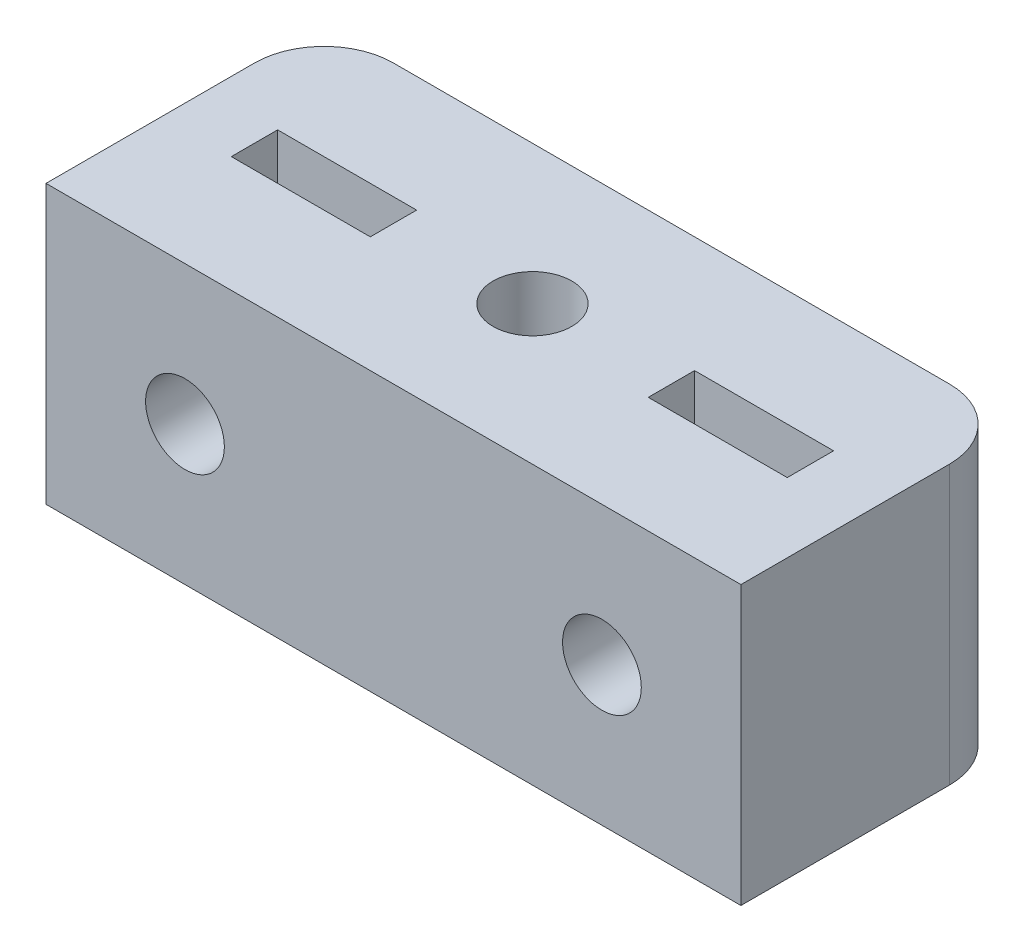
from build123d import *

# Parameters (mm, degrees)
SKETCH1_W           = 30
SKETCH1_H           = 12
BOSS_EXTRUDE1_DEPTH = 6
SKETCH2_R           = 1.7
CUT_EXTRUDE1_DEPTH  = 21.124611797
CUT_EXTRUDE2_DEPTH  = 1
SKETCH4_R           = 1.7
CUT_EXTRUDE3_DEPTH  = 21.124611797
CUT_EXTRUDE4_DEPTH  = 1
FILLET1_R           = 3


with BuildPart() as part:
    # Sketch1 → Boss-Extrude1 (new, symmetric)
    with BuildSketch(Plane(origin=(0, 0, 0), x_dir=(1, 0, 0), z_dir=(0, 1, 0))):
        Rectangle(SKETCH1_W, SKETCH1_H)
    extrude(amount=BOSS_EXTRUDE1_DEPTH, both=True)

    # Sketch2 → Cut-Extrude1 (cut, through all)
    with BuildSketch(Plane.XY.offset(6)):
        with Locations((-9, 0)):
            Circle(SKETCH2_R)
    cut_extrude1 = extrude(amount=-CUT_EXTRUDE1_DEPTH, mode=Mode.SUBTRACT)

    # Sketch3 → Cut-Extrude2 (cut, symmetric)
    with BuildSketch(Plane.XY):
        Polygon((-12, 3), (-12, 6), (-6, 6), (-6, 3), (-6, -3), (-12, -3), align=None)
    cut_extrude2 = extrude(amount=CUT_EXTRUDE2_DEPTH, both=True, mode=Mode.SUBTRACT)

    # Mirror1: Cut-Extrude1, Cut-Extrude2 across plane
    add(cut_extrude1.mirror(Plane(origin=(0, 0, 0), x_dir=(0, 0, 1), z_dir=(1, 0, 0))), mode=Mode.SUBTRACT)
    add(cut_extrude2.mirror(Plane(origin=(0, 0, 0), x_dir=(0, 0, 1), z_dir=(1, 0, 0))), mode=Mode.SUBTRACT)

    # Sketch4 → Cut-Extrude3 (cut, through all)
    with BuildSketch(Plane(origin=(0, 6, 0), x_dir=(1, 0, 0), z_dir=(0, 1, 0))):
        Circle(SKETCH4_R)
    extrude(amount=-CUT_EXTRUDE3_DEPTH, mode=Mode.SUBTRACT)

    # Sketch5 → Cut-Extrude4 (cut, symmetric)
    with BuildSketch(Plane(origin=(0, 0, 0), x_dir=(1, 0, 0), z_dir=(0, 1, 0))):
        Polygon((-3, 3), (-3, 6), (3, 6), (3, 3), (3, -3), (-3, -3), align=None)
    extrude(amount=CUT_EXTRUDE4_DEPTH, both=True, mode=Mode.SUBTRACT)

    # Fillet1
    fillet1_edges = [part.edges().sort_by_distance(p)[0] for p in [
        (-15, 0, -6),
        (15, 0, -6),
    ]]
    fillet(fillet1_edges, radius=FILLET1_R)


solid = part.part
